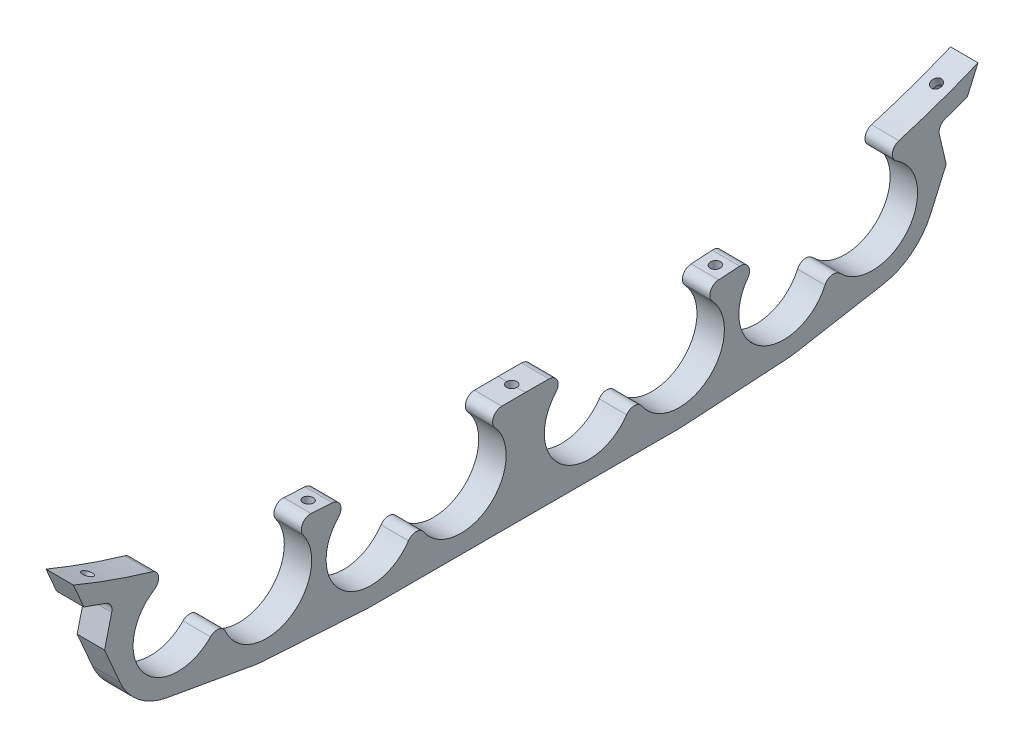
from build123d import *

# Parameters (mm, degrees)
BOSS_EXTRUDE15_DEPTH = 4.7625
SKETCH3_R            = 3.048
CUT_EXTRUDE1_DEPTH   = 3.556
SKETCH4_R            = 1.778
CUT_EXTRUDE2_DEPTH   = 3.556
SKETCH5_R            = 3.048
CUT_EXTRUDE3_DEPTH   = 3.556
SKETCH6_R            = 1.778
CUT_EXTRUDE4_DEPTH   = 161.944527072
SKETCH7_R            = 3.048
CUT_EXTRUDE5_DEPTH   = 3.556
SKETCH8_R            = 1.778
CUT_EXTRUDE6_DEPTH   = 171.543184329


with BuildPart() as part:
    # Sketch2 → Boss-Extrude15 (new, symmetric)
    with BuildSketch(Plane(origin=(-4.793990149, 0.020738599, -4e-09), x_dir=(-7.863770026849341e-10, 1.9135616294520948e-13, 1.0), z_dir=(-0.9999906431756386, 0.004325917379337551, -7.863704724843891e-10))):
        with BuildLine():
            Line((-142.069778069, -17.50744163), (-136.660048585, -29.919462974))
            ThreePointArc((-136.660048585, -29.919462974), (-130.118304274, -38.399329102), (-120.34612002, -42.781904043))
            Line((-120.34612002, -42.781904043), (-89.559122219, -48.241855431))
            ThreePointArc((-89.559122219, -48.241855431), (-88.316629056, -48.425765342), (-87.065660533, -48.538414678))
            Line((-87.065660533, -48.538414678), (-50.786388461, -50.762803282))
            ThreePointArc((-50.786388461, -50.762803282), (-50.090767834, -50.79440479), (-49.394495313, -50.803959287))
            Line((-49.394495313, -50.803959287), (-18.127145103, -50.803959287))
            Line((-18.127145103, -50.803959287), (4.097149246, -50.803959287))
            Line((4.097149246, -50.803959287), (4.097149246, -13.067323588))
            Line((4.097149246, -13.067323588), (-4.09851606, -13.103283275))
            ThreePointArc((-4.09851606, -13.103283275), (-6.993676206, -14.975727801), (-6.474185259, -18.3842656))
            ThreePointArc((-6.474185259, -18.3842656), (-8.607686117, -41.119556672), (-31.149927071, -37.473646798))
            ThreePointArc((-31.149927071, -37.473646798), (-33.791949862, -36.069475222), (-36.428004375, -37.484819296))
            ThreePointArc((-36.428004375, -37.484819296), (-59.171603962, -41.056668328), (-60.813626947, -18.092931955))
            ThreePointArc((-60.813626947, -18.092931955), (-60.178085187, -14.728334773), (-62.967966263, -12.743141807))
            Line((-62.967966263, -12.743141807), (-70.329704666, -12.283413558))
            ThreePointArc((-70.329704666, -12.283413558), (-73.347267175, -13.909916778), (-73.127776492, -17.330884486))
            ThreePointArc((-73.127776492, -17.330884486), (-77.895689712, -40.130616874), (-100.033117308, -32.885267131))
            ThreePointArc((-100.033117308, -32.885267131), (-102.385440582, -31.036332991), (-105.23011221, -31.963600792))
            ThreePointArc((-105.23011221, -31.963600792), (-128.637903334, -30.998069181), (-124.805009394, -7.886040697))
            ThreePointArc((-124.805009394, -7.886040697), (-123.344673509, -4.763292898), (-125.592585204, -2.149669412))
            add(Edge.make_bspline(
                [(-153.000328859, 7.571488864), (-148.595665874, 5.733885537), (-140.942098784, 2.778968757), (-133.161382772, 0.179475307), (-128.453267725, -1.29361855), (-127.024915098, -1.727525898), (-125.592585204, -2.149669412)],
                knots=[0.038380838, 0.038380838, 0.038380838, 0.038380838, 0.125, 0.1875, 0.1875, 0.214599597, 0.214599597, 0.214599597, 0.214599597], degree=3))
            Line((-153.000328859, 7.571488864), (-149.312325968, -0.890222713))
            Line((-149.312325968, -0.890222713), (-141.664687381, -3.606145772))
            ThreePointArc((-141.664687381, -3.606145772), (-139.937090283, -5.08288431), (-139.639164966, -7.336013013))
            Line((-139.639164966, -7.336013013), (-142.069778069, -17.50744163))
        make_face()
    boss_extrude15 = extrude(amount=BOSS_EXTRUDE15_DEPTH, both=True)

    # Sketch3 → Cut-Extrude1 (cut)
    with BuildSketch(Plane(origin=(-0.207114426, -47.877128408, -17.002871174), x_dir=(0.9999916910921595, -0.003841434970772692, -0.0013642301889163857), z_dir=(-0.004076487046836557, -0.9423317205495741, -0.33465551048718206))):
        with Locations((-4.590764779, -136.347253159)):
            Circle(SKETCH3_R)
    cut_extrude1 = extrude(amount=-CUT_EXTRUDE1_DEPTH, mode=Mode.SUBTRACT)

    # Sketch4 → Cut-Extrude2 (cut)
    with BuildSketch(Plane(origin=(-0.192618438, -44.526196809, -15.812836179), x_dir=(-0.9999916910921595, 0.0038414349707726093, 0.0013642301889163566), z_dir=(-0.004076487046836469, -0.942331720549574, -0.3346555104871821))):
        with Locations((4.590764779, 136.347253159)):
            Circle(SKETCH4_R)
    cut_extrude2 = extrude(amount=-CUT_EXTRUDE2_DEPTH, mode=Mode.SUBTRACT)

    # Sketch5 → Cut-Extrude3 (cut)
    with BuildSketch(Plane(origin=(-0.232193124, -53.674384819, -3.290964792), x_dir=(0.9999906782191565, -0.00430971576915608, -0.00026424378976682615), z_dir=(-0.004317809026733688, -0.9981163058039049, -0.06119801151650761))):
        with Locations((-4.781437249, -65.758320169)):
            Circle(SKETCH5_R)
    cut_extrude3 = extrude(amount=-CUT_EXTRUDE3_DEPTH, mode=Mode.SUBTRACT)

    # Sketch6 → Cut-Extrude4 (cut, through all)
    with BuildSketch(Plane(origin=(-0.216838995, -50.125083235, -3.073344663), x_dir=(-0.9999906782191565, 0.0043097157691561, 0.00026424378976682756), z_dir=(-0.004317809026733708, -0.9981163058039049, -0.06119801151650764))):
        with Locations((4.781437249, 65.758320169)):
            Circle(SKETCH6_R)
    cut_extrude4 = extrude(amount=-CUT_EXTRUDE4_DEPTH, mode=Mode.SUBTRACT)

    # Mirror1: Boss-Extrude15, Cut-Extrude1, Cut-Extrude2, Cut-Extrude3, Cut-Extrude4 across plane
    add(boss_extrude15.mirror(Plane(origin=(-0.251308445, -50.803347505, 4.097149246), x_dir=(1.0, 0, 7.863770026691667e-10), z_dir=(-7.863770026691667e-10, 1.913598077941815e-13, 1.0))))
    add(cut_extrude1.mirror(Plane(origin=(-0.251308445, -50.803347505, 4.097149246), x_dir=(1.0, 0, 7.863770026691667e-10), z_dir=(-7.863770026691667e-10, 1.913598077941815e-13, 1.0))), mode=Mode.SUBTRACT)
    add(cut_extrude2.mirror(Plane(origin=(-0.251308445, -50.803347505, 4.097149246), x_dir=(1.0, 0, 7.863770026691667e-10), z_dir=(-7.863770026691667e-10, 1.913598077941815e-13, 1.0))), mode=Mode.SUBTRACT)
    add(cut_extrude3.mirror(Plane(origin=(-0.251308445, -50.803347505, 4.097149246), x_dir=(1.0, 0, 7.863770026691667e-10), z_dir=(-7.863770026691667e-10, 1.913598077941815e-13, 1.0))), mode=Mode.SUBTRACT)
    add(cut_extrude4.mirror(Plane(origin=(-0.251308445, -50.803347505, 4.097149246), x_dir=(1.0, 0, 7.863770026691667e-10), z_dir=(-7.863770026691667e-10, 1.913598077941815e-13, 1.0))), mode=Mode.SUBTRACT)

    # Sketch7 → Cut-Extrude5 (cut)
    with BuildSketch(Plane(origin=(-0.21977373, -50.803483923, 0), x_dir=(0.9999906431756386, -0.004325917379337551, -1.3886757012277375e-14), z_dir=(-0.004325917379337551, -0.9999906431756386, -3.2100999299384647e-12))):
        with Locations((-4.794035051, 4.097149246)):
            Circle(SKETCH7_R)
    extrude(amount=-CUT_EXTRUDE5_DEPTH, mode=Mode.SUBTRACT)

    # Sketch8 → Cut-Extrude6 (cut, through all)
    with BuildSketch(Plane(origin=(-0.204390768, -47.247517196, 0), x_dir=(-0.9999906431756386, 0.004325917379337531, 1.3886673559645551e-14), z_dir=(-0.004325917379337531, -0.9999906431756386, -3.21008063880468e-12))):
        with Locations((4.794035051, -4.097149246)):
            Circle(SKETCH8_R)
    extrude(amount=-CUT_EXTRUDE6_DEPTH, mode=Mode.SUBTRACT)


solid = part.part
